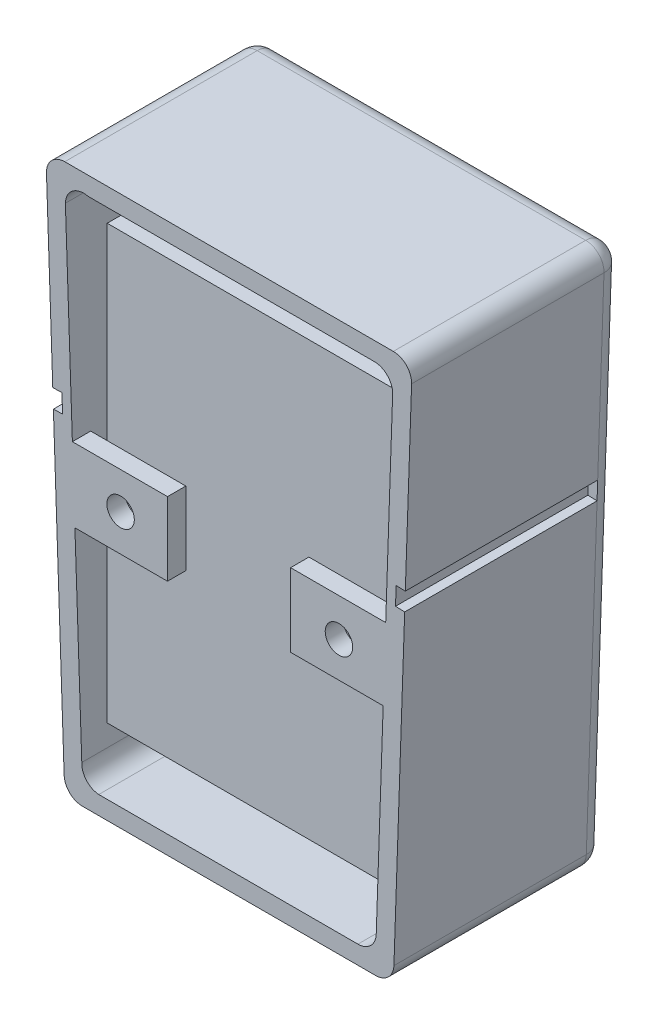
from build123d import *

# Parameters (mm, degrees)
SKETCH1_R           = 3.75
SKETCH1_R_2         = 12.75
BOSS_EXTRUDE1_DEPTH = 3.81
BOSS_EXTRUDE3_DEPTH = 25.4
BOSS_EXTRUDE4_DEPTH = 2.54
FILLET1_R           = 2.54
BOSS_EXTRUDE6_DEPTH = 2.54
SKETCH9_R           = 1.905
CUT_EXTRUDE1_DEPTH  = 2.54
CUT_EXTRUDE2_DEPTH  = 1.27
SKETCH11_W          = 26.67
SKETCH11_H          = 2.54
CUT_EXTRUDE3_DEPTH  = 1.27
SKETCH12_W          = 26.67
SKETCH12_H          = 2.54
CUT_EXTRUDE4_DEPTH  = 1.27
SKETCH13_W          = 39.9796
SKETCH13_H          = 59.9948
BOSS_EXTRUDE7_DEPTH = 10.16


with BuildPart() as part:
    # Sketch1 → Boss-Extrude1 (new body)
    with BuildSketch(Plane.XY):
        with BuildLine():
            ThreePointArc((-22.77090231, 76.154735329), (-24.597640016, 75.379566583), (-25.309393487, 73.527199387))
            Line((-25.309393487, 73.527199387), (-22.858491178, 2.452464058))
            ThreePointArc((-22.858491178, 2.452464058), (-22.084831254, 0.713262294), (-20.32, 0))
            Line((-20.32, 0), (20.32, 0))
            ThreePointArc((20.32, 0), (22.084831254, 0.713262294), (22.858491178, 2.452464058))
            Line((22.858491178, 2.452464058), (25.309393487, 73.527199387))
            ThreePointArc((25.309393487, 73.527199387), (24.597640016, 75.379566583), (22.77090231, 76.154735329))
            Line((22.77090231, 76.154735329), (-22.77090231, 76.154735329))
        make_face()
        with Locations((0, 58.539610149)):
            Circle(SKETCH1_R, mode=Mode.SUBTRACT)
        with Locations((0, 21.622308918)):
            Circle(SKETCH1_R_2, mode=Mode.SUBTRACT)
    extrude(amount=BOSS_EXTRUDE1_DEPTH)

    # Sketch4 → Boss-Extrude3 (add)
    with BuildSketch(Plane.XY.offset(3.81)):
        with BuildLine():
            Line((-22.77090231, 76.154735329), (22.77090231, 76.154735329))
            ThreePointArc((22.77090231, 76.154735329), (24.597640016, 75.379566583), (25.309393487, 73.527199387))
            Line((25.309393487, 73.527199387), (22.858491178, 2.452464058))
            ThreePointArc((22.858491178, 2.452464058), (22.084831254, 0.713262294), (20.32, 0))
            Line((20.32, 0), (-20.32, 0))
            ThreePointArc((-20.32, 0), (-22.084831254, 0.713262294), (-22.858491178, 2.452464058))
            Line((-22.858491178, 2.452464058), (-25.309393487, 73.527199387))
            ThreePointArc((-25.309393487, 73.527199387), (-24.597640016, 75.379566583), (-22.77090231, 76.154735329))
        make_face()
        with BuildLine():
            Line((-19.541270744, 73.614735329), (20.141804619, 73.614735329))
            ThreePointArc((20.141804619, 73.614735329), (21.968542325, 72.839566583), (22.680295797, 70.987199387))
            Line((22.680295797, 70.987199387), (20.404569365, 4.992462187))
            ThreePointArc((20.404569365, 4.992462187), (19.630909441, 3.253260423), (17.866078187, 2.539998129))
            Line((17.866078187, 2.539998129), (-18.061159176, 2.539998129))
            ThreePointArc((-18.061159176, 2.539998129), (-19.78310781, 3.39559701), (-20.412160003, 5.212586245))
            Line((-20.412160003, 5.212586245), (-22.687990425, 71.210339105))
            ThreePointArc((-22.687990425, 71.210339105), (-21.690891162, 73.166710129), (-19.541270744, 73.614735329))
        make_face(mode=Mode.SUBTRACT)
    extrude(amount=BOSS_EXTRUDE3_DEPTH)

    # Sketch7 → Boss-Extrude4 (add)
    with BuildSketch(Plane.XY.offset(13.335)):
        with BuildLine():
            Line((-19.537731311, 73.614735329), (20.145344052, 73.614735329))
            ThreePointArc((20.145344052, 73.614735329), (21.972081758, 72.839566583), (22.68383523, 70.987199387))
            Line((22.68383523, 70.987199387), (20.408108798, 4.992462187))
            ThreePointArc((20.408108798, 4.992462187), (19.634448874, 3.253260423), (17.86961762, 2.539998129))
            Line((17.86961762, 2.539998129), (-18.057619743, 2.539998129))
            ThreePointArc((-18.057619743, 2.539998129), (-19.730779532, 3.364707915), (-20.389382819, 5.109944754))
            Line((-20.389382819, 5.109944754), (-22.665213241, 71.107697614))
            ThreePointArc((-22.665213241, 71.107697614), (-21.714144758, 73.125513756), (-19.537731311, 73.614735329))
        make_face()
    extrude(amount=BOSS_EXTRUDE4_DEPTH)

    # Fillet1
    fillet1_edges = [part.edges().sort_by_distance(p)[0] for p in [
        (0, 76.154735329, 0),
        (-24.597640016, 75.379566583, 0),
        (-24.083942332, 37.989831723, 0),
        (-22.084831254, 0.713262294, 0),
        (0, 0, 0),
        (22.084831254, 0.713262294, 0),
        (24.083942332, 37.989831723, 0),
        (24.597640016, 75.379566583, 0),
    ]]
    fillet(fillet1_edges, radius=FILLET1_R)

    # Sketch8 → Boss-Extrude6 (add)
    with BuildSketch(Plane.XY.offset(29.21)):
        Polygon((-21.717608556, 43.069831723), (-8.531459132, 43.069831723), (-8.531459132, 32.909831723), (-21.367256671, 32.909831723), align=None)
        Polygon((8.531459132, 32.909831723), (21.367256671, 32.909831723), (21.717608556, 43.069831723), (8.531459132, 43.069831723), align=None)
    extrude(amount=-BOSS_EXTRUDE6_DEPTH)

    # Sketch9 → Cut-Extrude1 (cut)
    with BuildSketch(Plane.XY.offset(29.21)):
        with Locations((-15.036945873, 37.989831723)):
            Circle(SKETCH9_R)
        with Locations((15.237744036, 37.820383377)):
            Circle(SKETCH9_R)
    extrude(amount=-CUT_EXTRUDE1_DEPTH, mode=Mode.SUBTRACT)

    # Sketch10 → Cut-Extrude2 (cut)
    with BuildSketch(Plane(origin=(0, 0, 0), x_dir=(-1, 0, 0), z_dir=(0, 0, -1))):
        Polygon((-21.897084176, 48.274519863), (21.897084176, 48.274519863), (21.809496204, 45.734519863), (-21.809496204, 45.734519863), align=None)
    extrude(amount=-CUT_EXTRUDE2_DEPTH, mode=Mode.SUBTRACT)

    # Sketch11 → Cut-Extrude3 (cut)
    with BuildSketch(Plane(origin=(-22.746873247, -0.784390739, 0), x_dir=(0, 0, 1), z_dir=(-0.9994059754448638, -0.03446296918579016, 0))):
        with Locations((15.875, 47.745550873)):
            Rectangle(SKETCH11_W, SKETCH11_H)
    extrude(amount=-CUT_EXTRUDE3_DEPTH, mode=Mode.SUBTRACT)

    # Sketch12 → Cut-Extrude4 (cut)
    with BuildSketch(Plane(origin=(22.746873247, -0.784390739, 0), x_dir=(0, 0, -1), z_dir=(0.9994059754448638, -0.034462969185789866, 0))):
        with Locations((-15.875, 47.745550873)):
            Rectangle(SKETCH12_W, SKETCH12_H)
    extrude(amount=-CUT_EXTRUDE4_DEPTH, mode=Mode.SUBTRACT)

    # Sketch13 → Boss-Extrude7 (add)
    with BuildSketch(Plane.XY.offset(15.875)):
        with Locations((-0.0762, 38.537335329)):
            Rectangle(SKETCH13_W, SKETCH13_H)
    extrude(amount=BOSS_EXTRUDE7_DEPTH)


solid = part.part
